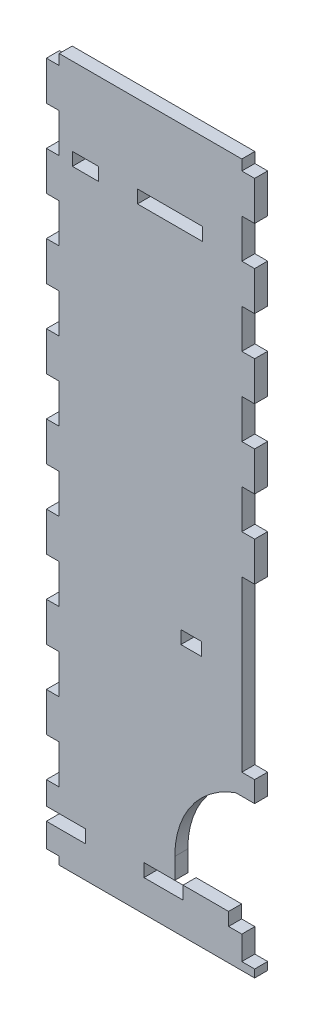
from build123d import *

# Parameters (mm, degrees)
BOSS_EXTRU_1_DEPTH      = 5
ESQUISSE2_W             = 8
ESQUISSE2_H             = 5
ESQUISSE2_W_2           = 15
ESQUISSE2_W_3           = 4.92
ESQUISSE2_H_2           = 65
ESQUISSE2_H_3           = 3
ESQUISSE2_H_4           = 15
ESQUISSE2_W_4           = 10
ESQUISSE2_W_5           = 25
ENL_V_MAT_EXTRU_1_DEPTH = 5
ESQUISSE3_W             = 7.280585373
ESQUISSE3_H             = 3.947256303
BOSS_EXTRU_2_DEPTH      = 5


with BuildPart() as part:
    # Esquisse1 → Boss.-Extru.1 (new body)
    with BuildSketch(Plane.XY):
        with BuildLine():
            Line((0, 0), (80, 0))
            Line((80, 0), (80, 17.15))
            Line((80, 17.15), (49.330858803, 17.15))
            Line((49.330858803, 17.15), (49.330858803, 25.109342079))
            add(Edge.make_bspline(
                [(80, 59.779072791), (49.330858803, 55.600211761), (49.330858803, 25.109342079)],
                knots=[1.708281914, 1.708281914, 1.708281914, 3.141592654, 3.141592654, 3.141592654], degree=2, weights=[1, 0.754006918, 1]))
            Line((80, 59.779072791), (80, 270))
            Line((80, 270), (0, 270))
            Line((0, 270), (0, 0))
        make_face()
    extrude(amount=BOSS_EXTRU_1_DEPTH)

    # Esquisse2 → Enlèv. mat.-Extru.1 (cut)
    with BuildSketch(Plane.XY.offset(5)):
        with Locations((55.679721659, 99.250434868)):
            Rectangle(ESQUISSE2_W, ESQUISSE2_H)
        Polygon((75.08, 12.15), (70, 12.15), (70, 17.15), (80, 17.15), (80, 3), (75.08, 3), align=None)
        with Locations((45, 14.65)):
            Rectangle(ESQUISSE2_W_2, ESQUISSE2_H)
        with Locations((7.5, 14.65)):
            Rectangle(ESQUISSE2_W_2, ESQUISSE2_H)
        with Locations((77.54, 98.5)):
            Rectangle(ESQUISSE2_W_3, ESQUISSE2_H_2)
        with Locations((2.46, 1.5)):
            Rectangle(ESQUISSE2_W_3, ESQUISSE2_H_3)
        with Locations((77.54, 183.5)):
            Rectangle(ESQUISSE2_W_3, ESQUISSE2_H_4)
        with Locations((77.54, 153.5)):
            Rectangle(ESQUISSE2_W_3, ESQUISSE2_H_4)
        with Locations((77.54, 213.5)):
            Rectangle(ESQUISSE2_W_3, ESQUISSE2_H_4)
        with Locations((77.54, 243.5)):
            Rectangle(ESQUISSE2_W_3, ESQUISSE2_H_4)
        with Locations((77.54, 273.5)):
            Rectangle(ESQUISSE2_W_3, ESQUISSE2_H_4)
        with Locations((2.46, 273.5)):
            Rectangle(ESQUISSE2_W_3, ESQUISSE2_H_4)
        with Locations((2.46, 243.5)):
            Rectangle(ESQUISSE2_W_3, ESQUISSE2_H_4)
        with Locations((2.46, 213.5)):
            Rectangle(ESQUISSE2_W_3, ESQUISSE2_H_4)
        with Locations((2.46, 183.5)):
            Rectangle(ESQUISSE2_W_3, ESQUISSE2_H_4)
        with Locations((2.46, 153.5)):
            Rectangle(ESQUISSE2_W_3, ESQUISSE2_H_4)
        with Locations((2.46, 123.5)):
            Rectangle(ESQUISSE2_W_3, ESQUISSE2_H_4)
        with Locations((2.46, 93.5)):
            Rectangle(ESQUISSE2_W_3, ESQUISSE2_H_4)
        with Locations((2.46, 63.5)):
            Rectangle(ESQUISSE2_W_3, ESQUISSE2_H_4)
        with Locations((2.46, 33.5)):
            Rectangle(ESQUISSE2_W_3, ESQUISSE2_H_4)
        with Locations((15, 237.5)):
            Rectangle(ESQUISSE2_W_4, ESQUISSE2_H)
        with Locations((47.5, 237.5)):
            Rectangle(ESQUISSE2_W_5, ESQUISSE2_H)
    extrude(amount=-ENL_V_MAT_EXTRU_1_DEPTH, mode=Mode.SUBTRACT)

    # Esquisse3 → Boss.-Extru.2 (add)
    with BuildSketch(Plane(origin=(0, 0, 0), x_dir=(-1, 0, 0), z_dir=(0, 0, -1))):
        with Locations((-76.359707313, 59.973628152)):
            Rectangle(ESQUISSE3_W, ESQUISSE3_H)
    extrude(amount=-BOSS_EXTRU_2_DEPTH)


solid = part.part
